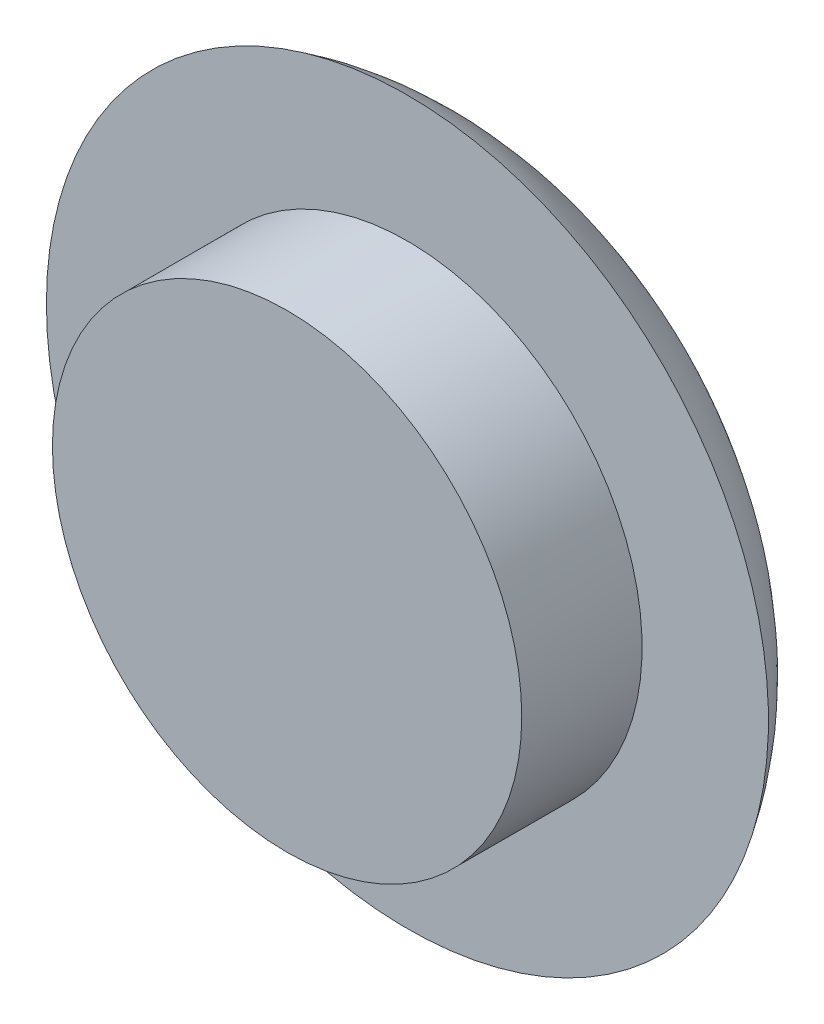
from build123d import *

# Parameters (mm, degrees)
SKETCH1_R           = 2.925
BOSS_EXTRUDE1_DEPTH = 1.5


with BuildPart() as part:
    # Sketch1 → Boss-Extrude1 (new body)
    with BuildSketch(Plane.XY):
        Circle(SKETCH1_R)
    extrude(amount=BOSS_EXTRUDE1_DEPTH)

    # Sketch2 → Revolve1 (revolve)
    with BuildSketch(Plane(origin=(0, 0, 0), x_dir=(1, 0, 0), z_dir=(0, 1, 0))):
        with BuildLine():
            Line((0, 1.4), (2, 1.4))
            ThreePointArc((2, 1.4), (3.432654878, 1.026169425), (4.5, 0))
            Line((4.5, 0), (0, 0))
            Line((0, 0), (0, 1.4))
        make_face()
    revolve(axis=Axis((0, 0, -1.4), (0, 0, 1)))


solid = part.part
